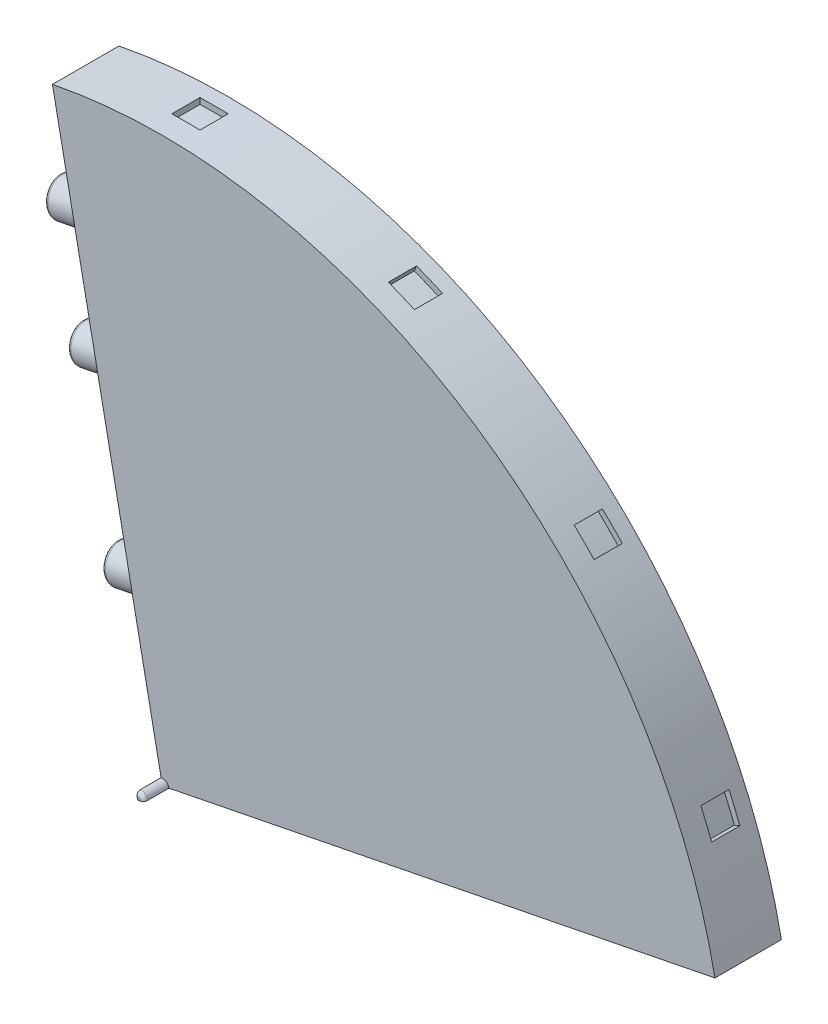
from build123d import *

# Parameters (mm, degrees)
BOSS_EXTRUDE1_START = -13.97
BOSS_EXTRUDE1_DEPTH = 7.62
SKETCH3_W           = 157.48
SKETCH3_H           = 157.48
CUT_EXTRUDE1_DEPTH  = 1
SKETCH3_3_R         = 1.8
BOSS_EXTRUDE2_DEPTH = 37
FILLET1_R           = 1
SKETCH11_R          = 5.1
CUT_EXTRUDE2_DEPTH  = 12.7
SKETCH10_R          = 5
BOSS_EXTRUDE3_DEPTH = 12.5
FILLET2_R           = 1


# Read off the part's stored shape, not the designer's step: Boss-Extrude1
with BuildPart() as part:
    # Sketch1 → Revolve1 (revolve)
    with BuildSketch(Plane.YZ, mode=Mode.PRIVATE) as revolve1_sk:
        Polygon((0, 0), (-152.4, 0), (-152.4, -6.35), (-150.8, -6.35), (-150.8, -13.97), (-152.4, -13.97), (-152.4, -17.97), (-88.9, -17.97), (-88.9, -23.97), (-111.6, -30.32), (0, -30.32), align=None)
    revolve(revolve1_sk.sketch.rotate(Axis((0, 0, -30.32), (0, 0, 1)), 180), axis=Axis((0, 0, -30.32), (0, 0, 1)))

    # Boss-Extrude1 outline → Boss-Extrude1 (add)
    with BuildSketch(Plane.XY.offset(BOSS_EXTRUDE1_START)):
        with BuildLine():
            Line((150.751862012, 3.81), (152.352367556, 3.81))
            ThreePointArc((152.352367556, 3.81), (149.471676733, 29.731765076), (142.213257992, 54.782745927))
            Line((142.213257992, 54.782745927), (140.734583678, 54.170258971))
            ThreePointArc((140.734583678, 54.170258971), (147.902420285, 29.41962056), (150.751862012, 3.81))
        make_face()
        with BuildLine():
            ThreePointArc((142.213257992, -54.782745926), (149.471676733, -29.731765075), (152.352367556, -3.81))
            Line((152.352367556, -3.81), (150.751862012, -3.81))
            ThreePointArc((150.751862012, -3.81), (147.902420285, -29.41962056), (140.734583678, -54.170258971))
            Line((140.734583678, -54.170258971), (142.213257992, -54.782745926))
        make_face()
        with BuildLine():
            Line((137.818535923, 61.210221009), (139.297210238, 61.822707964))
            ThreePointArc((139.297210238, 61.822707964), (126.715968915, 84.668903512), (110.423469065, 105.035315393))
            Line((110.423469065, 105.035315393), (109.291740741, 103.903587069))
            ThreePointArc((109.291740741, 103.903587069), (125.385617535, 83.77999114), (137.818535923, 61.210221009))
        make_face()
        with BuildLine():
            ThreePointArc((110.423469065, -105.035315392), (126.715968915, -84.668903512), (139.297210238, -61.822707964))
            Line((139.297210238, -61.822707964), (137.818535923, -61.210221009))
            ThreePointArc((137.818535923, -61.210221009), (125.385617535, -83.77999114), (109.291740741, -103.903587069))
            Line((109.291740741, -103.903587069), (110.423469065, -105.035315392))
        make_face()
        with BuildLine():
            Line((103.903587069, 109.291740741), (105.035315393, 110.423469065))
            ThreePointArc((105.035315393, 110.423469065), (84.668903512, 126.715968915), (61.822707964, 139.297210238))
            Line((61.822707964, 139.297210238), (61.210221009, 137.818535923))
            ThreePointArc((61.210221009, 137.818535923), (83.77999114, 125.385617535), (103.903587069, 109.291740741))
        make_face()
        with BuildLine():
            ThreePointArc((61.822707964, -139.297210238), (84.668903512, -126.715968915), (105.035315393, -110.423469065))
            Line((105.035315393, -110.423469065), (103.903587069, -109.291740741))
            ThreePointArc((103.903587069, -109.291740741), (83.77999114, -125.385617535), (61.210221009, -137.818535923))
            Line((61.210221009, -137.818535923), (61.822707964, -139.297210238))
        make_face()
        with BuildLine():
            Line((54.170258971, 140.734583678), (54.782745927, 142.213257992))
            ThreePointArc((54.782745927, 142.213257992), (29.731765076, 149.471676733), (3.81, 152.352367556))
            Line((3.81, 152.352367556), (3.81, 150.751862012))
            ThreePointArc((3.81, 150.751862012), (29.41962056, 147.902420285), (54.170258971, 140.734583678))
        make_face()
        with BuildLine():
            ThreePointArc((3.81, -152.352367556), (29.731765076, -149.471676733), (54.782745927, -142.213257992))
            Line((54.782745927, -142.213257992), (54.170258971, -140.734583678))
            ThreePointArc((54.170258971, -140.734583678), (29.41962056, -147.902420285), (3.81, -150.751862012))
            Line((3.81, -150.751862012), (3.81, -152.352367556))
        make_face()
        with BuildLine():
            Line((-3.81, 150.751862012), (-3.81, 152.352367556))
            ThreePointArc((-3.81, 152.352367556), (-29.731765076, 149.471676733), (-54.782745927, 142.213257992))
            Line((-54.782745927, 142.213257992), (-54.170258971, 140.734583678))
            ThreePointArc((-54.170258971, 140.734583678), (-29.41962056, 147.902420285), (-3.81, 150.751862012))
        make_face()
        with BuildLine():
            ThreePointArc((-54.782745926, -142.213257992), (-29.731765075, -149.471676733), (-3.81, -152.352367556))
            Line((-3.81, -152.352367556), (-3.81, -150.751862012))
            ThreePointArc((-3.81, -150.751862012), (-29.41962056, -147.902420285), (-54.170258971, -140.734583678))
            Line((-54.170258971, -140.734583678), (-54.782745926, -142.213257992))
        make_face()
        with BuildLine():
            Line((-61.210221009, 137.818535923), (-61.822707964, 139.297210238))
            ThreePointArc((-61.822707964, 139.297210238), (-84.668903512, 126.715968915), (-105.035315393, 110.423469065))
            Line((-105.035315393, 110.423469065), (-103.903587069, 109.291740741))
            ThreePointArc((-103.903587069, 109.291740741), (-83.77999114, 125.385617535), (-61.210221009, 137.818535923))
        make_face()
        with BuildLine():
            ThreePointArc((-105.035315392, -110.423469065), (-84.668903512, -126.715968915), (-61.822707964, -139.297210238))
            Line((-61.822707964, -139.297210238), (-61.210221009, -137.818535923))
            ThreePointArc((-61.210221009, -137.818535923), (-83.77999114, -125.385617535), (-103.903587069, -109.291740741))
            Line((-103.903587069, -109.291740741), (-105.035315392, -110.423469065))
        make_face()
        with BuildLine():
            Line((-109.291740741, 103.903587069), (-110.423469065, 105.035315393))
            ThreePointArc((-110.423469065, 105.035315393), (-126.715968915, 84.668903512), (-139.297210238, 61.822707964))
            Line((-139.297210238, 61.822707964), (-137.818535923, 61.210221009))
            ThreePointArc((-137.818535923, 61.210221009), (-125.385617535, 83.77999114), (-109.291740741, 103.903587069))
        make_face()
        with BuildLine():
            ThreePointArc((-139.297210238, -61.822707964), (-126.715968915, -84.668903512), (-110.423469065, -105.035315393))
            Line((-110.423469065, -105.035315393), (-109.291740741, -103.903587069))
            ThreePointArc((-109.291740741, -103.903587069), (-125.385617535, -83.77999114), (-137.818535923, -61.210221009))
            Line((-137.818535923, -61.210221009), (-139.297210238, -61.822707964))
        make_face()
        with BuildLine():
            Line((-140.734583678, 54.170258971), (-142.213257992, 54.782745926))
            ThreePointArc((-142.213257992, 54.782745926), (-149.471676733, 29.731765075), (-152.352367556, 3.81))
            Line((-152.352367556, 3.81), (-150.751862012, 3.81))
            ThreePointArc((-150.751862012, 3.81), (-147.902420285, 29.41962056), (-140.734583678, 54.170258971))
        make_face()
        with BuildLine():
            ThreePointArc((-152.352367556, -3.81), (-149.471676733, -29.731765076), (-142.213257992, -54.782745927))
            Line((-142.213257992, -54.782745927), (-140.734583678, -54.170258971))
            ThreePointArc((-140.734583678, -54.170258971), (-147.902420285, -29.41962056), (-150.751862012, -3.81))
            Line((-150.751862012, -3.81), (-152.352367556, -3.81))
        make_face()
    extrude(amount=BOSS_EXTRUDE1_DEPTH)

    # Sketch3 → Cut-Extrude1 (cut)
    with BuildSketch(Plane(origin=(0, 0, -30.32), x_dir=(1, 0, 0), z_dir=(0, 0, -1))):
        Rectangle(SKETCH3_W, SKETCH3_H)
    extrude(amount=-CUT_EXTRUDE1_DEPTH, mode=Mode.SUBTRACT)

    # Sketch3<3> → Boss-Extrude2 (add)
    with BuildSketch(Plane(origin=(0, 0, -30.32), x_dir=(1, 0, 0), z_dir=(0, 0, -1))):
        with Locations(Location((0, 0, 0), (0, 0, 180))):
            Circle(SKETCH3_3_R)
    extrude(amount=-BOSS_EXTRUDE2_DEPTH)

    # Fillet1
    fillet1_edges = [part.edges().sort_by_distance(p)[0] for p in [
        (1.8, 0, 6.68),
    ]]
    fillet(fillet1_edges, radius=FILLET1_R)

    # Split2
    split(bisect_by=Plane(origin=(0, 0, 0), x_dir=(-0.9807852804032318, -0.19509032201612173, 0), z_dir=(0.19509032201612173, -0.9807852804032318, 0)), keep=Keep.BOTTOM)

    # Split3
    split(bisect_by=Plane(origin=(0, 0, 0), x_dir=(0.1951383847238072, -0.9807757189120169, 0), z_dir=(-0.9807757189120169, -0.1951383847238072, 0)), keep=Keep.BOTTOM)

    # Sketch11 → Cut-Extrude2 (cut)
    with BuildSketch(Plane(origin=(0, 0, 0), x_dir=(0.9807852804032318, 0.19509032201612175, 0), z_dir=(0.19509032201612175, -0.9807852804032318, 0))):
        with Locations((88.9, -8.985)):
            Circle(SKETCH11_R)
        with Locations((120.65, -8.985)):
            Circle(SKETCH11_R)
        with Locations((41.041303899, -8.985)):
            Circle(SKETCH11_R)
    extrude(amount=-CUT_EXTRUDE2_DEPTH, mode=Mode.SUBTRACT)

    # Sketch10 → Boss-Extrude3 (add)
    with BuildSketch(Plane(origin=(0, 0, 0), x_dir=(0.19513838472380637, -0.980775718912017, 0), z_dir=(-0.980775718912017, -0.19513838472380637, 0))):
        with Locations((-120.65, -8.985)):
            Circle(SKETCH10_R)
        with Locations((-88.9, -8.985)):
            Circle(SKETCH10_R)
        with Locations((-41.041695232, -8.985)):
            Circle(SKETCH10_R)
    extrude(amount=BOSS_EXTRUDE3_DEPTH)

    # Fillet2
    fillet2_edges = [part.edges().sort_by_distance(p)[0] for p in [
        (-36.778834527, 120.795239272, -8.985),
        (-30.583190812, 89.655610197, -8.985),
        (-21.244198524, 42.717346933, -8.985),
    ]]
    fillet(fillet2_edges, radius=FILLET2_R)


solid = part.part
